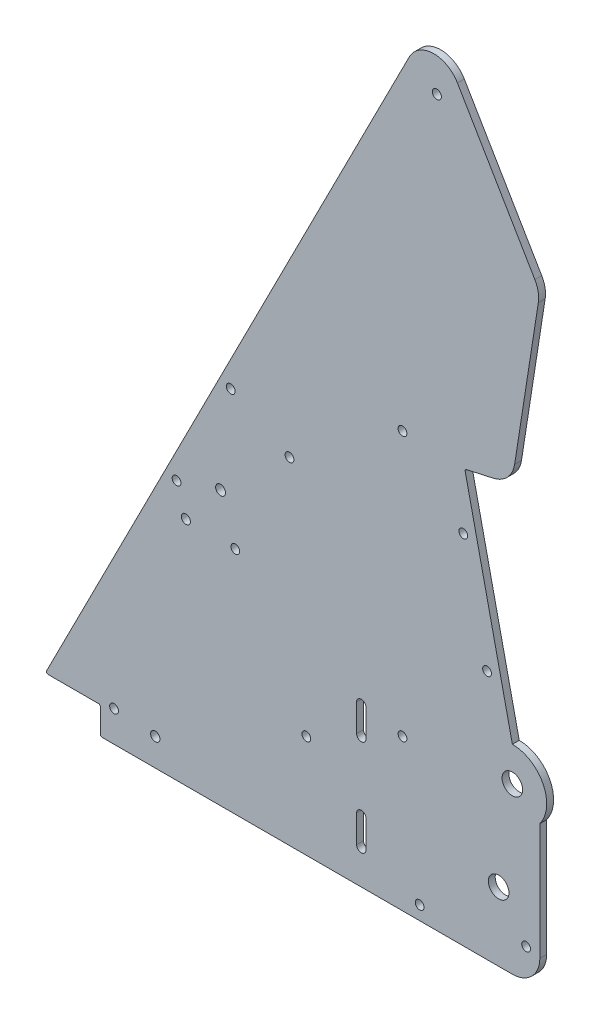
from build123d import *

# Parameters (mm, degrees)
BOSS_EXTRUDE1_DEPTH = 3.175
SKETCH2_R           = 2.0955
SKETCH2_R_2         = 2.286
SKETCH2_R_3         = 2.032
SKETCH2_R_4         = 4.7625
CUT_EXTRUDE1_DEPTH  = 421.976111717
SKETCH7_R           = 2.159
CUT_EXTRUDE2_DEPTH  = 421.976111717
CUT_EXTRUDE3_REACH  = 422.976
SKETCH10_R          = 2.032
FILLET1_R           = 12.7
FILLET2_R           = 0.79375
SKETCH12_R          = 2.032
CUT_EXTRUDE5_DEPTH  = 410.593447353


with BuildPart() as part:
    # Sketch1 → Boss-Extrude1 (new body)
    with BuildSketch(Plane.XY):
        with BuildLine():
            Line((228.6, -12.7), (228.6, 53.975))
            ThreePointArc((228.6, 53.975), (230.099031657, 70.599515829), (215.9, 79.375))
            Line((215.9, 79.375), (193.909735224, 178.566674323))
            Line((193.909735224, 178.566674323), (215.607913982, 183.377044743))
            Line((215.607913982, 183.377044743), (228.6, 266.7))
            Line((228.6, 266.7), (178.754725958, 351.413083686))
            Line((178.754725958, 351.413083686), (0, 0))
            Line((0, 0), (25.4, 0))
            Line((25.4, 0), (25.4, -12.7))
            Line((25.4, -12.7), (228.6, -12.7))
        make_face()
    extrude(amount=BOSS_EXTRUDE1_DEPTH)

    # Sketch2 → Cut-Extrude1 (cut, through all)
    with BuildSketch(Plane.XY.offset(3.175)):
        with Locations((64.943150167, 94.057839899)):
            Circle(SKETCH2_R)
        with Locations((180.975, 322.164313376)):
            Circle(SKETCH2_R)
        with Locations((81.00705334, 113.73297687)):
            Circle(SKETCH2_R_2)
        with Locations((193.207821773, 152.394364194)):
            Circle(SKETCH2_R_3)
        with Locations((215.9, 63.5)):
            Circle(SKETCH2_R_4)
        with Locations((173.0375, -6.35)):
            Circle(SKETCH2_R_3)
        with Locations((204.202954161, 102.798527032)):
            Circle(SKETCH2_R_3)
        with Locations((209.55, 19.05)):
            Circle(SKETCH2_R_4)
        with Locations((60.657757175, 107.341986975)):
            Circle(SKETCH2_R_3)
        with Locations((165.1, 179.3875)):
            Circle(SKETCH2_R_3)
        with Locations((87.824985877, 93.522721993)):
            Circle(SKETCH2_R_3)
        with Locations((112.872403657, 142.763324016)):
            Circle(SKETCH2_R_3)
        with Locations((85.705174955, 156.582588998)):
            Circle(SKETCH2_R_3)
    extrude(amount=-CUT_EXTRUDE1_DEPTH, mode=Mode.SUBTRACT)

    # Sketch7 → Cut-Extrude2 (cut, through all)
    with BuildSketch(Plane.XY.offset(3.175)):
        with Locations((50.8, 0)):
            Circle(SKETCH7_R)
        with BuildLine():
            Line((143.891, 3.175), (143.891, 15.875))
            ThreePointArc((143.891, 15.875), (146.05, 18.034), (148.209, 15.875))
            Line((148.209, 15.875), (148.209, 3.175))
            ThreePointArc((148.209, 3.175), (146.05, 1.016), (143.891, 3.175))
        make_face()
        with BuildLine():
            Line((143.891, 47.625), (143.891, 60.325))
            ThreePointArc((143.891, 60.325), (146.05, 62.484), (148.209, 60.325))
            Line((148.209, 60.325), (148.209, 47.625))
            ThreePointArc((148.209, 47.625), (146.05, 45.466), (143.891, 47.625))
        make_face()
    extrude(amount=-CUT_EXTRUDE2_DEPTH, mode=Mode.SUBTRACT)

    # Sketch10 → Cut-Extrude3 (cut, up to next)
    with BuildSketch(Plane.XY.offset(3.175), mode=Mode.PRIVATE) as cut_extrude3_sk1:
        with Locations((120.65, 34.925)):
            Circle(SKETCH10_R)
    cut_extrude3_tool1 = extrude(cut_extrude3_sk1.sketch, amount=-CUT_EXTRUDE3_REACH, mode=Mode.PRIVATE) & part.part
    # Sketch10 → Cut-Extrude3 (cut, up to next)
    with BuildSketch(Plane.XY.offset(3.175), mode=Mode.PRIVATE) as cut_extrude3_sk2:
        with Locations((165.1, 57.15)):
            Circle(SKETCH10_R)
    cut_extrude3_tool2 = extrude(cut_extrude3_sk2.sketch, amount=-CUT_EXTRUDE3_REACH, mode=Mode.PRIVATE) & part.part
    add(cut_extrude3_tool1.solids().sort_by_distance((120.65, 34.925, 3.175))[0], mode=Mode.SUBTRACT)
    add(cut_extrude3_tool2.solids().sort_by_distance((165.1, 57.15, 3.175))[0], mode=Mode.SUBTRACT)

    # Fillet1
    fillet1_edges = [part.edges().sort_by_distance(p)[0] for p in [
        (228.6, -12.7, 1.5875),
        (178.754725958, 351.413083686, 1.5875),
        (215.607913982, 183.377044743, 1.5875),
        (228.6, 266.7, 1.5875),
    ]]
    fillet(fillet1_edges, radius=FILLET1_R)

    # Fillet2
    fillet2_edges = [part.edges().sort_by_distance(p)[0] for p in [
        (25.4, -12.7, 1.5875),
        (25.4, 0, 1.5875),
        (193.909735224, 178.566674323, 1.5875),
        (0, 0, 1.5875),
    ]]
    fillet(fillet2_edges, radius=FILLET2_R)

    # Sketch12 → Cut-Extrude5 (cut, through all)
    with BuildSketch(Plane.XY.offset(3.175)):
        with Locations((31.75, 1.5875)):
            Circle(SKETCH12_R)
        with Locations((173.0375, -6.35)):
            Circle(SKETCH12_R)
        with Locations((222.25, 1.5875)):
            Circle(SKETCH12_R)
    extrude(amount=-CUT_EXTRUDE5_DEPTH, mode=Mode.SUBTRACT)


solid = part.part
